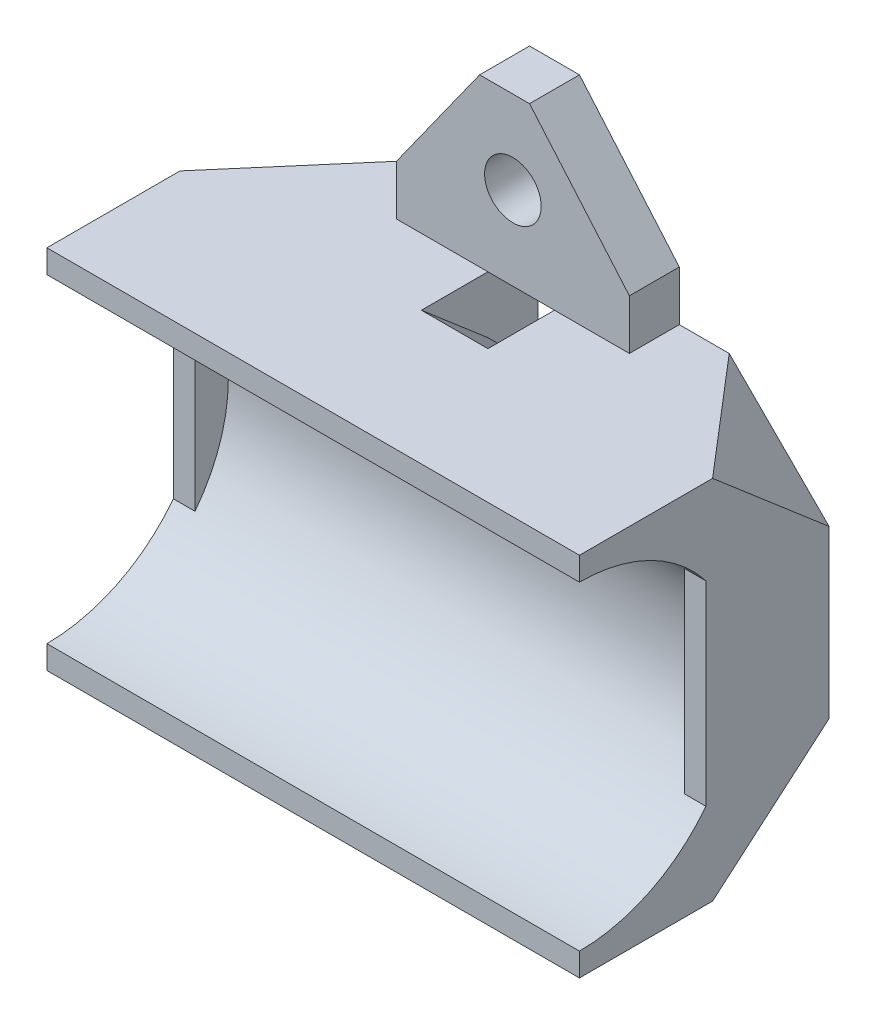
from build123d import *
from OCP.BRepFilletAPI import BRepFilletAPI_MakeChamfer
from build123d.topology import SkipClean

# Parameters (mm, degrees)
BOSS_EXTRU_1_DEPTH           = 15
ENL_V_START                  = -1.3
ESQUISSE2_R                  = 9.6
ENL_V_MAT_EXTRU_1_DEPTH      = 29.4
ENL_V_MAT_EXTRU_2_DEPTH      = 36.895542898805694
ENL_V_MAT_EXTRU_2_DEPTH_BACK = 36.895542898805694
BOSS_EXTRU_2_DEPTH           = 3
ESQUISSE6_R                  = 1.7
ENL_V_MAT_EXTRU_3_DEPTH      = 30.000000000000014
CHANFREIN1_SIZE              = 5
CHANFREIN1_SIZE2             = 7
CHANFREIN2_SIZE              = 7
CHANFREIN2_SIZE2             = 6
CHANFREIN3_START             = 12.698865856
CHANFREIN3_OUTLINE_W         = 11
CHANFREIN3_OUTLINE_H         = 12.000000000000002
CHANFREIN3_DEPTH             = 4.301134144
CHANFREIN4_START             = 12.698865856
CHANFREIN4_OUTLINE_W         = 11
CHANFREIN4_OUTLINE_H         = 12.000000000000002
CHANFREIN4_DEPTH             = 4.301134144
CHANFREIN5_START             = -17
CHANFREIN5_OUTLINE_W         = 11
CHANFREIN5_OUTLINE_H         = 12.000000000000002
CHANFREIN5_DEPTH             = 4.301134144
CHANFREIN6_START             = -17
CHANFREIN6_OUTLINE_W         = 11
CHANFREIN6_OUTLINE_H         = 12.000000000000002
CHANFREIN6_DEPTH             = 4.301134144
ENL_V_START_2                = -13.5
ENL_V_MAT_EXTRU_4_DEPTH      = 4


with BuildPart() as part:
    # Esquisse1 → Boss.-Extru.1 (new body)
    with BuildSketch(Plane.XY):
        Polygon((-16.000000000000007, 11.000000000000002), (15.999999999999993, 11.000000000000002), (15.999999999999996, -11), (-16, -11), align=None)
    extrude(amount=BOSS_EXTRU_1_DEPTH)

    # Esquisse2 → Enlèv. mat.-Extru.1 (cut)
    with BuildSketch(Plane(origin=(15.999999999999996, 2.52e-15, 0), x_dir=(0, 0, -1), z_dir=(1, 1.6e-16, 0)).offset(ENL_V_START)):
        with Locations((-15, -1.73e-15)):
            Circle(ESQUISSE2_R)
    extrude(amount=-ENL_V_MAT_EXTRU_1_DEPTH, mode=Mode.SUBTRACT)

    # Esquisse4 → Enlèv. mat.-Extru.2 (cut, two sides: drawn at the far end of the back side and taken through both)
    with SkipClean():  # the faces are left unmerged after this step: merging them gives an invalid solid
        with BuildSketch(Plane(origin=(-14.700000000000001, -2.32e-15, 0), x_dir=(0, 0, -1), z_dir=(1, 1.6e-16, 0)).offset(-ENL_V_MAT_EXTRU_2_DEPTH_BACK)):
            with BuildLine():
                Line((-7.3999999999999995, -5.865151319446073), (-7.3999999999999995, 5.865151319446073))
                ThreePointArc((-7.3999999999999995, 5.865151319446073), (-10.76593886833709, 8.615841591704243), (-15.000000000000032, 9.599999999999998))
                Line((-15.000000000000032, 9.599999999999998), (-15, -9.600000000000001))
                ThreePointArc((-15, -9.600000000000001), (-10.765938868337066, -8.615841591704251), (-7.3999999999999995, -5.865151319446073))
            make_face()
        extrude(amount=ENL_V_MAT_EXTRU_2_DEPTH + ENL_V_MAT_EXTRU_2_DEPTH_BACK, mode=Mode.SUBTRACT)

    # Esquisse5 → Boss.-Extru.2 (add)
    with BuildSketch(Plane(origin=(0, 0, 0), x_dir=(-1, 0, 0), z_dir=(0, 0, -1))):
        Polygon((7.000000000000008, -11), (-6.999999999999992, -11.000000000000002), (-6.999999999999991, -20.999999999999993), (7.000000000000009, -20.999999999999996), align=None)
        Polygon((7.000000000000006, 11.000000000000002), (-6.999999999999994, 11), (-6.999999999999992, 20.999999999999996), (7.000000000000008, 20.999999999999996), align=None)
    extrude(amount=-BOSS_EXTRU_2_DEPTH)

    # Esquisse6 → Enlèv. mat.-Extru.3 (cut, through all)
    with BuildSketch(Plane.XY.offset(3)):
        with Locations((0, -15.999999999999996)):
            Circle(ESQUISSE6_R)
        with Locations((8.7e-16, 15.999999999999996)):
            Circle(ESQUISSE6_R)
    extrude(amount=-ENL_V_MAT_EXTRU_3_DEPTH, mode=Mode.SUBTRACT)

    # Chanfrein1: one chamfer whose edges measure the first distance from different faces: ONE call of the kernel's chamfer builder (chamfer() names one face for all edges)
    chanfrein1_edges_1 = [part.edges().sort_by_distance(p)[0] for p in [
        (6.999999999999991, -20.999999999999993, 1.5),
    ]]
    chanfrein1_side_1 = [part.faces().sort_by_distance(p)[0] for p in [
        (-9.13e-15, -20.999999999999993, 1.5),
    ]]
    chanfrein1_edges_2 = [part.edges().sort_by_distance(p)[0] for p in [
        (-7.000000000000008, 20.999999999999996, 1.5),
    ]]
    chanfrein1_side_2 = [part.faces().sort_by_distance(p)[0] for p in [
        (-8.24e-15, 20.999999999999996, 1.5),
    ]]
    chanfrein1 = BRepFilletAPI_MakeChamfer(part.part.solid().wrapped)
    for e in chanfrein1_edges_1:
        chanfrein1.Add(CHANFREIN1_SIZE, CHANFREIN1_SIZE2, e.wrapped, chanfrein1_side_1[0].wrapped)  # the first distance lies on this face
    for e in chanfrein1_edges_2:
        chanfrein1.Add(CHANFREIN1_SIZE, CHANFREIN1_SIZE2, e.wrapped, chanfrein1_side_2[0].wrapped)  # the first distance lies on this face
    add(Compound.cast(chanfrein1.Shape()), mode=Mode.REPLACE)

    # Chanfrein2: one chamfer whose edges measure the first distance from different faces: ONE call of the kernel's chamfer builder (chamfer() names one face for all edges)
    chanfrein2_edges_1 = [part.edges().sort_by_distance(p)[0] for p in [
        (6.999999999999992, 20.999999999999996, 1.5),
    ]]
    chanfrein2_side_1 = [part.faces().sort_by_distance(p)[0] for p in [
        (6.999999999999993, 15.999999999999998, 1.5),
    ]]
    chanfrein2_edges_2 = [part.edges().sort_by_distance(p)[0] for p in [
        (-7.000000000000009, -20.999999999999996, 1.5),
    ]]
    chanfrein2_side_2 = [part.faces().sort_by_distance(p)[0] for p in [
        (-7.000000000000009, -15.999999999999998, 1.5),
    ]]
    chanfrein2 = BRepFilletAPI_MakeChamfer(part.part.solid().wrapped)
    for e in chanfrein2_edges_1:
        chanfrein2.Add(CHANFREIN2_SIZE, CHANFREIN2_SIZE2, e.wrapped, chanfrein2_side_1[0].wrapped)  # the first distance lies on this face
    for e in chanfrein2_edges_2:
        chanfrein2.Add(CHANFREIN2_SIZE, CHANFREIN2_SIZE2, e.wrapped, chanfrein2_side_2[0].wrapped)  # the first distance lies on this face
    add(Compound.cast(chanfrein2.Shape()), mode=Mode.REPLACE)

    # Chanfrein3: read off the stored shape, not the designer's step
    # Chanfrein3 outline → Chanfrein3 (cut)
    with BuildSketch(Plane(origin=(0, 0, 0), x_dir=(0.7964473354898962, 0.4591284639882932, 0.39353868341853704), z_dir=(0.6047078979069521, -0.6047078979069521, -0.5183210553488161)).offset(CHANFREIN3_START)):
        with Locations((6.5, 8)):
            Rectangle(CHANFREIN3_OUTLINE_W, CHANFREIN3_OUTLINE_H)
    extrude(amount=CHANFREIN3_DEPTH, mode=Mode.SUBTRACT)

    # Chanfrein4: read off the stored shape, not the designer's step
    # Chanfrein4 outline → Chanfrein4 (cut)
    with BuildSketch(Plane(origin=(0, 0, 0), x_dir=(0.7964473354898962, -0.45912846398829327, 0.39353868341853704), z_dir=(0.6047078979069521, 0.6047078979069522, -0.5183210553488161)).offset(CHANFREIN4_START)):
        with Locations((6.5, -8)):
            Rectangle(CHANFREIN4_OUTLINE_W, CHANFREIN4_OUTLINE_H)
    extrude(amount=CHANFREIN4_DEPTH, mode=Mode.SUBTRACT)

    # Chanfrein5: read off the stored shape, not the designer's step
    # Chanfrein5 outline → Chanfrein5 (cut)
    with BuildSketch(Plane(origin=(0, 0, 0), x_dir=(0.7964473354898962, 0.45912846398829327, -0.39353868341853704), z_dir=(0.6047078979069521, -0.6047078979069522, 0.5183210553488161)).offset(CHANFREIN5_START)):
        with Locations((-6.5, 8)):
            Rectangle(CHANFREIN5_OUTLINE_W, CHANFREIN5_OUTLINE_H)
    extrude(amount=CHANFREIN5_DEPTH, mode=Mode.SUBTRACT)

    # Chanfrein6: read off the stored shape, not the designer's step
    # Chanfrein6 outline → Chanfrein6 (cut)
    with BuildSketch(Plane(origin=(0, 0, 0), x_dir=(0.7964473354898959, -0.4591284639882932, -0.3935386834185371), z_dir=(0.6047078979069522, 0.6047078979069521, 0.5183210553488161)).offset(CHANFREIN6_START)):
        with Locations((-6.5, -8)):
            Rectangle(CHANFREIN6_OUTLINE_W, CHANFREIN6_OUTLINE_H)
    extrude(amount=CHANFREIN6_DEPTH, mode=Mode.SUBTRACT)

    # Esquisse7 → Enlèv. mat.-Extru.4 (cut)
    with BuildSketch(Plane(origin=(15.999999999999996, 2.52e-15, 0), x_dir=(0, 0, -1), z_dir=(1, 1.6e-16, 0)).offset(ENL_V_START_2)):
        Polygon((-3, -7.571428571428581), (-3, 7.571428571428564), (-7.000000000000009, 11), (-3.000000000000009, 11), (-4.5e-16, 8.428571428571422), (1.83e-15, -8.428571428571436), (-2.999999999999989, -11.000000000000002), (-6.9999999999999885, -11.000000000000002), align=None)
    extrude(amount=-ENL_V_MAT_EXTRU_4_DEPTH, mode=Mode.SUBTRACT)


solid = part.part
